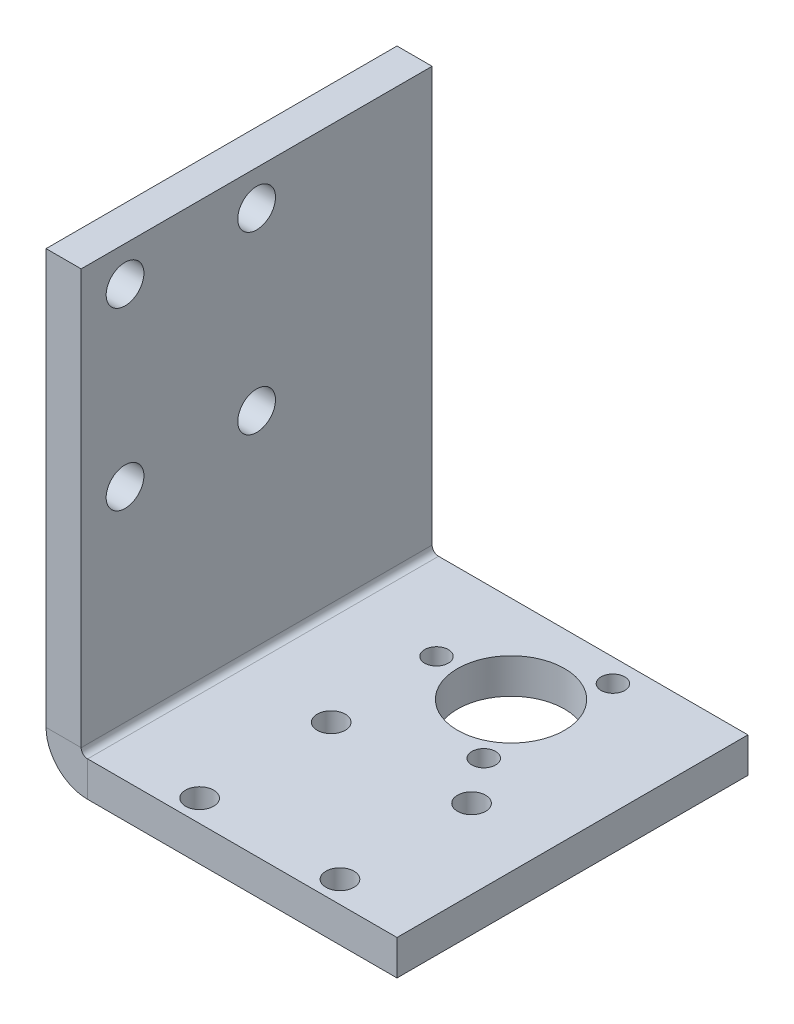
from build123d import *

# Parameters (mm, degrees)
SM_BASE_FLANGE_2_DEPTH   = 20
HOLE_WIZARD_M3_1_D       = 3.2
SKETCH_24_R              = 6.1
CUT_EXTRUDE_2_DEPTH      = 67.332495807
HOLE_WIZARD_M4_1_D       = 4.3
HOLE_WIZARD_M2_5_1_D     = 2.7
PATTERN_CIRCULAR_1_COUNT = 3


# Sheet-metal steps are written as plain solids
with BuildPart() as part:
    # 草圖16 → 基材-凸緣2 (new, symmetric)
    with BuildSketch(Plane.XY):
        with BuildLine():
            Line((36, 0), (0.7366, 0))
            ThreePointArc((0.7366, 0), (0.215745145, 0.215745145), (0, 0.7366))
            Line((0, 0.7366), (0, 48))
            Line((0, 48), (-4, 48))
            Line((-4, 48), (-4, 0.7366))
            ThreePointArc((-4, 0.7366), (-2.61268198, -2.61268198), (0.7366, -4))
            Line((0.7366, -4), (36, -4))
            Line((36, -4), (36, 0))
        make_face()
    extrude(amount=SM_BASE_FLANGE_2_DEPTH, both=True)

    # M3 餘隙孔1 (through all)
    with Locations(Plane(origin=(0, 0, 0), x_dir=(-1, 0, 0), z_dir=(0, 1, 0))):
        with Locations((-27, 17.5), (-11, 2.5), (-11, 17.5), (-27, 2.5)):
            Hole(HOLE_WIZARD_M3_1_D / 2)

    # 草圖24 → 除料-伸長2 (cut, through all)
    with BuildSketch(Plane.XZ.offset(4)):
        with Locations(Location((19, -10, 0), (0, 0, 270))):
            Circle(SKETCH_24_R)
    extrude(amount=-CUT_EXTRUDE_2_DEPTH, mode=Mode.SUBTRACT)

    # M4 餘隙孔1 (through all)
    with Locations(Plane(origin=(0, 0, 0), x_dir=(0, 0, 1), z_dir=(1, 0, 0))):
        with Locations((0, -44), (15, -44), (15, -24), (0, -24)):
            Hole(HOLE_WIZARD_M4_1_D / 2)

    # M2.5 餘隙孔1 (through all)
    with Locations(Plane(origin=(0, -4, 0), x_dir=(-1, 0, 0), z_dir=(0, -1, 0))):
        with Locations((-10.5, 10)):
            hole_wizard_m2_5_1 = Hole(HOLE_WIZARD_M2_5_1_D / 2)

    # 環狀複製排列1: M2.5 餘隙孔1 ×3 about axis
    pattern_circular_1_axis = Axis((19, 0, -10), (0, 1, 0))
    for i in range(1, PATTERN_CIRCULAR_1_COUNT):
        add(hole_wizard_m2_5_1.rotate(pattern_circular_1_axis, i * 360 / PATTERN_CIRCULAR_1_COUNT), mode=Mode.SUBTRACT)


solid = part.part
